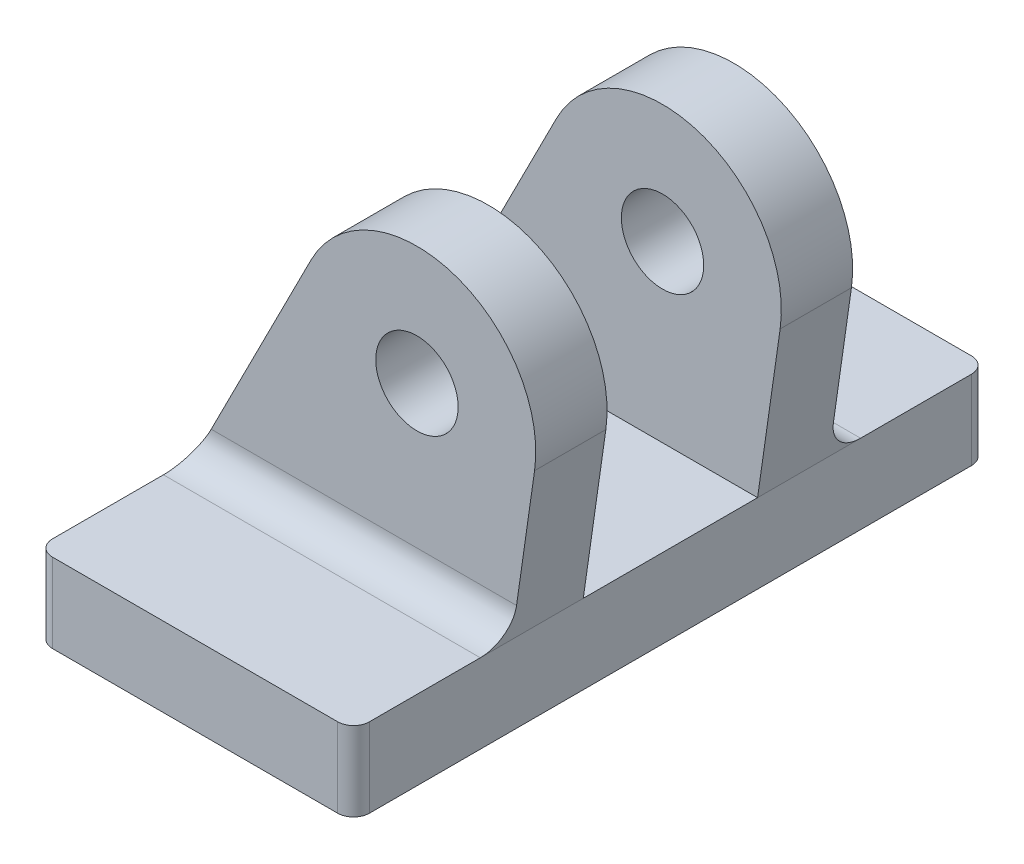
from build123d import *

# Parameters (mm, degrees)
SKETCH1_R           = 2.6
BOSS_EXTRUDE1_DEPTH = 10
SKETCH1_3_W         = 20
SKETCH1_3_H         = 5
BOSS_EXTRUDE2_DEPTH = 20
SKETCH1_4_R         = 2.6
CUT_EXTRUDE1_DEPTH  = 5.5
SKETCH2_R           = 2
BOSS_EXTRUDE3_DEPTH = 4
FILLET1_R           = 1
FILLET2_R           = 2


with BuildPart() as part:
    # Sketch1 → Boss-Extrude1 (new, symmetric)
    with BuildSketch(Plane.XY):
        with BuildLine():
            Line((-2.686718641, 19.396732815), (-10, 5))
            Line((-10, 5), (10, 5))
            Line((10, 5), (11.424127203, 14.935887565))
            ThreePointArc((11.424127203, 14.935887565), (6.260691915, 23.151172776), (-2.686718641, 19.396732815))
        make_face()
        with Locations((4, 16)):
            Circle(SKETCH1_R, mode=Mode.SUBTRACT)
    extrude(amount=BOSS_EXTRUDE1_DEPTH, both=True)

    # Sketch1<3> → Boss-Extrude2 (add, symmetric)
    with BuildSketch(Plane.XY):
        with Locations((0, 2.5)):
            Rectangle(SKETCH1_3_W, SKETCH1_3_H)
    extrude(amount=BOSS_EXTRUDE2_DEPTH, both=True)

    # Sketch1<4> → Cut-Extrude1 (cut, symmetric)
    with BuildSketch(Plane.XY):
        with BuildLine():
            ThreePointArc((11.424127203, 14.935887565), (6.260691915, 23.151172776), (-2.686718641, 19.396732815))
            Line((-2.686718641, 19.396732815), (-10, 5))
            Line((-10, 5), (10, 5))
            Line((10, 5), (11.424127203, 14.935887565))
        make_face()
        with Locations((4, 16)):
            Circle(SKETCH1_4_R, mode=Mode.SUBTRACT)
    extrude(amount=CUT_EXTRUDE1_DEPTH, both=True, mode=Mode.SUBTRACT)

    # Sketch2 → Boss-Extrude3 (add)
    with BuildSketch(Plane.XZ):
        with Locations(Location((0, 10, 0), (0, 0, 90))):
            Circle(SKETCH2_R)
        with Locations(Location((0, -10, 0), (0, 0, 90))):
            Circle(SKETCH2_R)
    extrude(amount=BOSS_EXTRUDE3_DEPTH)

    # Fillet1
    fillet1_edges = [part.edges().sort_by_distance(p)[0] for p in [
        (-10, 2.5, -20),
        (10, 2.5, 20),
        (-10, 2.5, 20),
        (10, 2.5, -20),
    ]]
    fillet(fillet1_edges, radius=FILLET1_R)

    # Fillet2
    # the kernel refuses this fillet: 2 mm, written as the material it adds along each edge
    with BuildSketch(Plane(origin=(-10, 5, 10), x_dir=(0, 0, 1), z_dir=(1, 0, 0))) as fillet2_piece_1_section:
        with BuildLine():
            CenterArc((FILLET2_R, -FILLET2_R), FILLET2_R, 90, 90)
            Line((0, -FILLET2_R), (0, 0))
            Line((0, 0), (FILLET2_R, 0))
        make_face()
    fillet2_piece_1 = extrude(amount=20, mode=Mode.PRIVATE)
    fillet2_piece_1 = split(fillet2_piece_1, bisect_by=Plane(origin=(-7.744522427, 9.440073667, 10.455584543), z_dir=(0.8915624854306203, -0.45289770872988017, 0)), keep=Keep.TOP, mode=Mode.PRIVATE)
    fillet2_piece_1 = split(fillet2_piece_1, bisect_by=Plane(origin=(9.863918043, 4.050579875, 10.455584543), z_dir=(-0.9898836270660257, 0.14188165796398555, 0)), keep=Keep.TOP, mode=Mode.PRIVATE)
    add(fillet2_piece_1)
    with BuildSketch(Plane(origin=(-10, 5, 10), x_dir=(0, 0, 1), z_dir=(1, 0, 0))) as fillet2_piece_2_section:
        with BuildLine():
            CenterArc((FILLET2_R, -FILLET2_R), FILLET2_R, 90, 90)
            Line((0, -FILLET2_R), (0, 0))
            Line((0, 0), (FILLET2_R, 0))
        make_face()
    fillet2_piece_2 = extrude(amount=25, mode=Mode.PRIVATE)
    fillet2_piece_2 = split(fillet2_piece_2, bisect_by=Plane(origin=(10, 5.860236103, 10.212945025), z_dir=(1, 0, 0)), keep=Keep.TOP, mode=Mode.PRIVATE)
    fillet2_piece_2 = split(fillet2_piece_2, bisect_by=Plane(origin=(10.122058034, 5.851577653, 10.212945025), z_dir=(-0.9898836270660257, 0.14188165796398555, 0)), keep=Keep.TOP, mode=Mode.PRIVATE)
    add(fillet2_piece_2)
    with BuildSketch(Plane(origin=(-10, 5, -10), x_dir=(0, 0, -1), z_dir=(1, 0, 0))) as fillet2_piece_3_section:
        with BuildLine():
            CenterArc((FILLET2_R, FILLET2_R), FILLET2_R, 180, 90)
            Line((0, FILLET2_R), (0, 0))
            Line((0, 0), (FILLET2_R, 0))
        make_face()
    fillet2_piece_3 = extrude(amount=20, mode=Mode.PRIVATE)
    fillet2_piece_3 = split(fillet2_piece_3, bisect_by=Plane(origin=(-7.744522427, 9.440073667, -10.455584543), z_dir=(0.8915624854306203, -0.45289770872988017, 0)), keep=Keep.TOP, mode=Mode.PRIVATE)
    fillet2_piece_3 = split(fillet2_piece_3, bisect_by=Plane(origin=(9.863918043, 4.050579875, -10.455584543), z_dir=(-0.9898836270660257, 0.14188165796398555, 0)), keep=Keep.TOP, mode=Mode.PRIVATE)
    add(fillet2_piece_3)
    with BuildSketch(Plane(origin=(-10, 5, -10), x_dir=(0, 0, -1), z_dir=(1, 0, 0))) as fillet2_piece_4_section:
        with BuildLine():
            CenterArc((FILLET2_R, FILLET2_R), FILLET2_R, 180, 90)
            Line((0, FILLET2_R), (0, 0))
            Line((0, 0), (FILLET2_R, 0))
        make_face()
    fillet2_piece_4 = extrude(amount=25, mode=Mode.PRIVATE)
    fillet2_piece_4 = split(fillet2_piece_4, bisect_by=Plane(origin=(10, 5.860236103, -10.212945025), z_dir=(1, 0, 0)), keep=Keep.TOP, mode=Mode.PRIVATE)
    fillet2_piece_4 = split(fillet2_piece_4, bisect_by=Plane(origin=(10.122058034, 5.851577653, -10.212945025), z_dir=(-0.9898836270660257, 0.14188165796398555, 0)), keep=Keep.TOP, mode=Mode.PRIVATE)
    add(fillet2_piece_4)


solid = part.part
